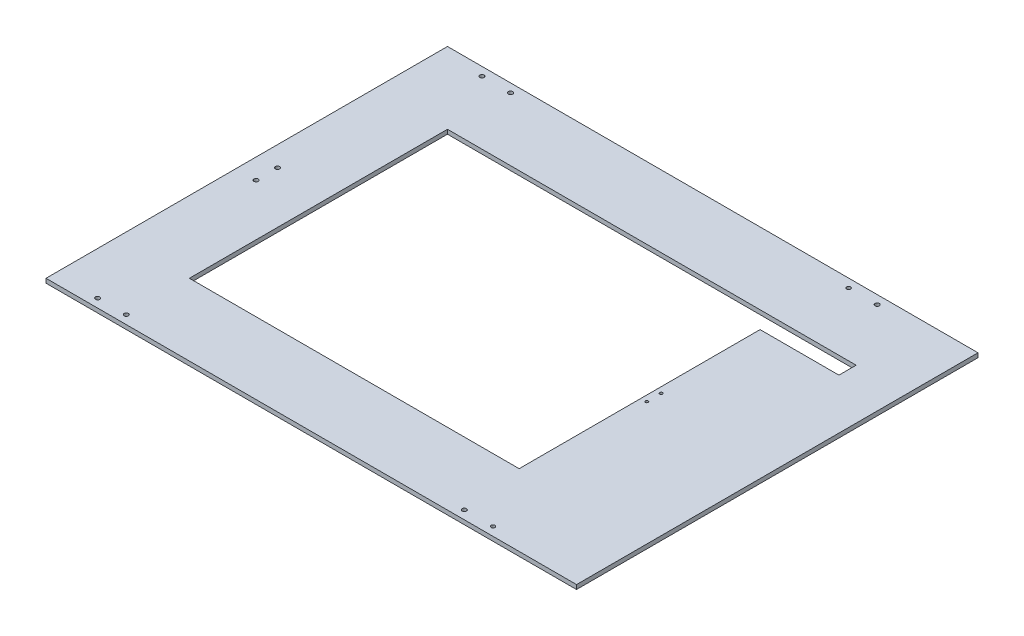
from build123d import *

# Parameters (mm, degrees)
SKETCH1_W           = 370
SKETCH1_H           = 280
SKETCH1_R           = 1.5
SKETCH1_R_2         = 1.569181713
SKETCH1_R_3         = 1.357318829
SKETCH1_R_4         = 1.322467774
SKETCH1_R_5         = 1
SKETCH1_W_2         = 230
SKETCH1_H_2         = 180
BOSS_EXTRUDE1_DEPTH = 3
SKETCH2_W           = 55
SKETCH2_H           = 12
CUT_EXTRUDE1_DEPTH  = 10
SKETCH3_R           = 1.5
CUT_EXTRUDE2_DEPTH  = 10


with BuildPart() as part:
    # Sketch1 → Boss-Extrude1 (new body)
    with BuildSketch(Plane(origin=(0, 0, 0), x_dir=(1, 0, 0), z_dir=(0, 1, 0))):
        with Locations((185, 140)):
            Rectangle(SKETCH1_W, SKETCH1_H)
        with Locations((30, 274)):
            Circle(SKETCH1_R, mode=Mode.SUBTRACT)
        with Locations((50, 274)):
            Circle(SKETCH1_R_2, mode=Mode.SUBTRACT)
        with Locations((30, 6)):
            Circle(SKETCH1_R, mode=Mode.SUBTRACT)
        with Locations((50, 6)):
            Circle(SKETCH1_R, mode=Mode.SUBTRACT)
        with Locations((285.756924446, 273.985388104)):
            Circle(SKETCH1_R_3, mode=Mode.SUBTRACT)
        with Locations((305.756860025, 273.934625414)):
            Circle(SKETCH1_R, mode=Mode.SUBTRACT)
        with Locations((285.756860726, 6.001523901)):
            Circle(SKETCH1_R, mode=Mode.SUBTRACT)
        with Locations((305.756860025, 6.006818111)):
            Circle(SKETCH1_R_4, mode=Mode.SUBTRACT)
        with Locations((284, 145)):
            Circle(SKETCH1_R_5, mode=Mode.SUBTRACT)
        with Locations((284, 135)):
            Circle(SKETCH1_R_5, mode=Mode.SUBTRACT)
        with Locations((165, 140)):
            Rectangle(SKETCH1_W_2, SKETCH1_H_2, mode=Mode.SUBTRACT)
    extrude(amount=BOSS_EXTRUDE1_DEPTH)

    # Sketch2 → Cut-Extrude1 (cut)
    with BuildSketch(Plane(origin=(0, 3, 0), x_dir=(1, 0, 0), z_dir=(0, 1, 0))):
        with Locations((307.5, 224)):
            Rectangle(SKETCH2_W, SKETCH2_H)
    extrude(amount=-CUT_EXTRUDE1_DEPTH, mode=Mode.SUBTRACT)

    # Sketch3 → Cut-Extrude2 (cut)
    with BuildSketch(Plane(origin=(0, 3, 0), x_dir=(1, 0, 0), z_dir=(0, 1, 0))):
        with Locations((14, 147.5)):
            Circle(SKETCH3_R)
        with Locations((14, 132.5)):
            Circle(SKETCH3_R)
    extrude(amount=-CUT_EXTRUDE2_DEPTH, mode=Mode.SUBTRACT)


solid = part.part
